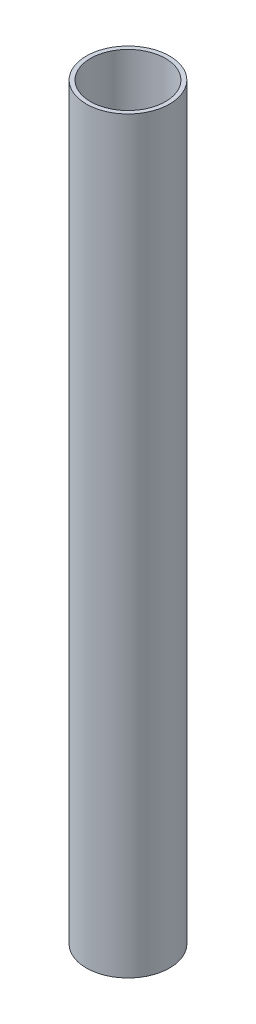
from build123d import *

# Parameters (mm, degrees)
SKETCH1_R           = 10
SKETCH1_R_2         = 9
BOSS_EXTRUDE1_DEPTH = 179.7


with BuildPart() as part:
    # Sketch1 → Boss-Extrude1 (new body)
    with BuildSketch(Plane(origin=(0, 0, 0), x_dir=(1, 0, 0), z_dir=(0, 1, 0))):
        Circle(SKETCH1_R)
        Circle(SKETCH1_R_2, mode=Mode.SUBTRACT)
    extrude(amount=BOSS_EXTRUDE1_DEPTH)


solid = part.part
